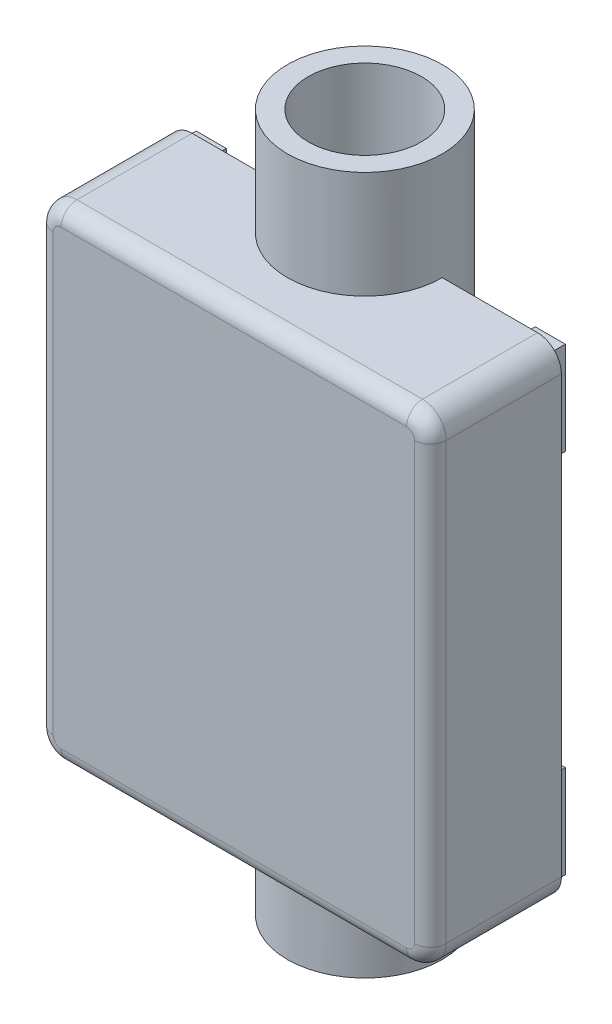
from build123d import *
from build123d.topology import SkipClean

# Parameters (mm, degrees)
BOSS_EXTRUDE1_DEPTH     = 30
BOSS_EXTRUDE2_START     = 3
BOSS_EXTRUDE2_DEPTH     = 3
SKETCH3_R               = 16.5
CUT_EXTRUDE1_DEPTH      = 134
FILLET1_R               = 4
BOSS_EXTRUDE4_DEPTH     = 10
FILLET2_R               = 4
SKETCH6_W               = 7.6
SKETCH6_H               = 23.39
SKETCH6_R               = 1.8
SKETCH6_W_2             = 4.808261044
SKETCH6_H_2             = 7.212391568
SKETCH6_H_3             = 5.330898115
SKETCH6_W_3             = 4.181096561
SKETCH6_H_4             = 6.376172255
SKETCH6_H_5             = 6.418199303
SKETCH6_H_6             = 6.534893836
BOSS_EXTRUDE5_DEPTH     = 34
FILLET5_R               = 7.5
FILLET6_R               = 7.5
FILLET7_R               = 7.5
FILLET8_R               = 7.5
SKETCH8_R               = 19.5
SKETCH8_R_2             = 14.25
BOSS_EXTRUDE6_DEPTH     = 95.74
BOSS_EXTRUDE8_START     = 40
SKETCH10_R              = 19.5
SKETCH10_R_2            = 14.25
BOSS_EXTRUDE8_DEPTH     = 40
SKETCH11_R              = 19.5
SKETCH11_R_2            = 14.25
BOSS_EXTRUDE9_DEPTH     = 40
CUT_EXTRUDE2_DEPTH      = 40
CUT_EXTRUDE2_DEPTH_BACK = 26
SKETCH12_R              = 2.5
FILLET9_R               = 4
SKETCH14_W              = 20.11766778
SKETCH14_H              = 69.863173562
SKETCH14_W_2            = 12.619264335
SKETCH14_H_2            = 61.633218561
BOSS_EXTRUDE10_DEPTH    = 14.8


with BuildPart() as part:
    # Sketch1 → Boss-Extrude1 (new body)
    with BuildSketch(Plane(origin=(0, 0, 0), x_dir=(0, 1, 0), z_dir=(0, 0, 1))):
        with BuildLine():
            Line((-54.87, 49.5), (54.87, 49.5))
            ThreePointArc((54.87, 49.5), (59.112640687, 47.742640687), (60.87, 43.5))
            Line((60.87, 43.5), (60.87, -43.5))
            ThreePointArc((60.87, -43.5), (59.112640687, -47.742640687), (54.87, -49.5))
            Line((54.87, -49.5), (-54.87, -49.5))
            ThreePointArc((-54.87, -49.5), (-59.112640687, -47.742640687), (-60.87, -43.5))
            Line((-60.87, -43.5), (-60.87, 43.5))
            ThreePointArc((-60.87, 43.5), (-59.112640687, 47.742640687), (-54.87, 49.5))
        make_face()
        with BuildLine():
            Line((-54.87, 46.5), (54.87, 46.5))
            ThreePointArc((54.87, 46.5), (56.991320344, 45.621320344), (57.87, 43.5))
            Line((57.87, 43.5), (57.87, -43.5))
            ThreePointArc((57.87, -43.5), (56.991320344, -45.621320344), (54.87, -46.5))
            Line((54.87, -46.5), (-54.87, -46.5))
            ThreePointArc((-54.87, -46.5), (-56.991320344, -45.621320344), (-57.87, -43.5))
            Line((-57.87, -43.5), (-57.87, 43.5))
            ThreePointArc((-57.87, 43.5), (-56.991320344, 45.621320344), (-54.87, 46.5))
        make_face(mode=Mode.SUBTRACT)
    extrude(amount=-BOSS_EXTRUDE1_DEPTH)

    # Sketch2 → Boss-Extrude2 (add)
    with BuildSketch(Plane.XY.offset(BOSS_EXTRUDE2_START)):
        with BuildLine():
            Line((-43.5, -60.87), (43.5, -60.87))
            ThreePointArc((43.5, -60.87), (47.742640687, -59.112640687), (49.5, -54.87))
            Line((49.5, -54.87), (49.5, 54.87))
            ThreePointArc((49.5, 54.87), (47.742640687, 59.112640687), (43.5, 60.87))
            Line((43.5, 60.87), (-43.5, 60.87))
            ThreePointArc((-43.5, 60.87), (-47.742640687, 59.112640687), (-49.5, 54.87))
            Line((-49.5, 54.87), (-49.5, -54.87))
            ThreePointArc((-49.5, -54.87), (-47.742640687, -59.112640687), (-43.5, -60.87))
        make_face()
    extrude(amount=-BOSS_EXTRUDE2_DEPTH)

    # Sketch3 → Cut-Extrude1 (cut)
    with BuildSketch(Plane(origin=(0, 60.87, 0), x_dir=(-1, 0, 0), z_dir=(0, 1, 0))):
        with Locations((0, -30)):
            Circle(SKETCH3_R)
    extrude(amount=-CUT_EXTRUDE1_DEPTH, mode=Mode.SUBTRACT)

    # Fillet1
    fillet1_edges = [part.edges().sort_by_distance(p)[0] for p in [
        (-47.742640687, -59.112640687, 3),
        (0, -60.87, 3),
        (47.742640687, -59.112640687, 3),
        (49.5, 0, 3),
        (47.742640687, 59.112640687, 3),
        (0, 60.87, 3),
        (-47.742640687, 59.112640687, 3),
        (-49.5, 0, 3),
    ]]
    fillet(fillet1_edges, radius=FILLET1_R)

    # Sketch5 → Boss-Extrude4 (add, symmetric)
    with SkipClean():  # the faces are left unmerged after this step: merging them gives an invalid solid
        with BuildSketch(Plane(origin=(0, -57.87, 0), x_dir=(-1, 0, 0), z_dir=(0, 1, 0))):
            with BuildLine():
                Line((-19.5, -30), (-16.5, -30))
                ThreePointArc((-16.5, -30), (0, -13.5), (16.5, -30))
                Line((16.5, -30), (19.5, -30))
                ThreePointArc((19.5, -30), (0, -10.5), (-19.5, -30))
            make_face()
        boss_extrude4 = extrude(amount=BOSS_EXTRUDE4_DEPTH, both=True)
    add(part.part.scale(1), mode=Mode.REPLACE)  # the faces are merged on a copy

    # Fillet2
    fillet2_edges = [part.edges().sort_by_distance(p)[0] for p in [
        (0, -57.87, -10.5),
    ]]
    fillet(fillet2_edges, radius=FILLET2_R)

    # Mirror2: Boss-Extrude4 across plane
    add(boss_extrude4.mirror(Plane.ZX))

    # Sketch6 → Boss-Extrude5 (add)
    # profile 1 of 4: a face of its own
    with BuildSketch(Plane(origin=(0, 0, 0), x_dir=(1, 0, 0), z_dir=(0, 0, -1))):
        with Locations((-42.7, 46.175)):
            Rectangle(SKETCH6_W, SKETCH6_H)
        with Locations(Location((-42.7, 46.175, 0), (0, 0, 180))):
            Circle(SKETCH6_R, mode=Mode.SUBTRACT)
        with Locations((-42.751499239, 52.734887691)):
            Rectangle(SKETCH6_W_2, SKETCH6_H_2, mode=Mode.SUBTRACT)
        with Locations((-42.751499239, 38.728214213)):
            Rectangle(SKETCH6_W_2, SKETCH6_H_3, mode=Mode.SUBTRACT)
    # profile 2 of 4: a face of its own
    with BuildSketch(Plane(origin=(0, 0, 0), x_dir=(1, 0, 0), z_dir=(0, 0, -1))):
        with Locations((42.7, 46.175)):
            Rectangle(SKETCH6_W, SKETCH6_H)
        with Locations((42.7, 46.175)):
            Circle(SKETCH6_R, mode=Mode.SUBTRACT)
        with Locations((42.647398016, 52.734887691)):
            Rectangle(SKETCH6_W_3, SKETCH6_H_2, mode=Mode.SUBTRACT)
        with Locations((42.647398016, 39.250851283)):
            Rectangle(SKETCH6_W_3, SKETCH6_H_4, mode=Mode.SUBTRACT)
    # profile 3 of 4: a face of its own
    with BuildSketch(Plane(origin=(0, 0, 0), x_dir=(1, 0, 0), z_dir=(0, 0, -1))):
        with Locations((-42.7, -46.175)):
            Rectangle(SKETCH6_W, SKETCH6_H)
        with Locations((-42.7, -46.175)):
            Circle(SKETCH6_R, mode=Mode.SUBTRACT)
        with Locations((-42.751499239, -39.688362672)):
            Rectangle(SKETCH6_W_2, SKETCH6_H_5, mode=Mode.SUBTRACT)
        with Locations((-42.751499239, -53.399970274)):
            Rectangle(SKETCH6_W_2, SKETCH6_H_6, mode=Mode.SUBTRACT)
    # profile 4 of 4: a face of its own
    with BuildSketch(Plane(origin=(0, 0, 0), x_dir=(1, 0, 0), z_dir=(0, 0, -1))):
        with Locations((42.7, -46.175)):
            Rectangle(SKETCH6_W, SKETCH6_H)
        with Locations(Location((42.7, -46.175, 0), (0, 0, 180))):
            Circle(SKETCH6_R, mode=Mode.SUBTRACT)
        with Locations((42.647398016, -39.688362672)):
            Rectangle(SKETCH6_W_3, SKETCH6_H_5, mode=Mode.SUBTRACT)
        with Locations((42.647398016, -53.399970274)):
            Rectangle(SKETCH6_W_3, SKETCH6_H_6, mode=Mode.SUBTRACT)
    extrude(amount=BOSS_EXTRUDE5_DEPTH)

    # Fillet5
    fillet5_edges = [part.edges().sort_by_distance(p)[0] for p in [
        (-46.5, 34.48, -15),
    ]]
    fillet(fillet5_edges, radius=FILLET5_R)

    # Fillet6
    fillet6_edges = [part.edges().sort_by_distance(p)[0] for p in [
        (-46.5, -34.48, -15),
    ]]
    fillet(fillet6_edges, radius=FILLET6_R)

    # Fillet7
    fillet7_edges = [part.edges().sort_by_distance(p)[0] for p in [
        (46.5, -34.48, -15),
    ]]
    fillet(fillet7_edges, radius=FILLET7_R)

    # Fillet8
    fillet8_edges = [part.edges().sort_by_distance(p)[0] for p in [
        (46.5, 34.48, -15),
    ]]
    fillet(fillet8_edges, radius=FILLET8_R)

    # Sketch8 → Boss-Extrude6 (add)
    with BuildSketch(Plane(origin=(0, -47.87, 0), x_dir=(-1, 0, 0), z_dir=(0, 1, 0))):
        with Locations((0, -30)):
            Circle(SKETCH8_R)
        with Locations(Location((0, -30, 0), (0, 0, 270))):
            Circle(SKETCH8_R_2, mode=Mode.SUBTRACT)
    extrude(amount=BOSS_EXTRUDE6_DEPTH)

    # Sketch10 → Boss-Extrude8 (add)
    with SkipClean():  # the faces are left unmerged after this step: merging them gives an invalid solid
        with BuildSketch(Plane.XZ.offset(47.87).offset(BOSS_EXTRUDE8_START)):
            with Locations((0, -30)):
                Circle(SKETCH10_R)
            with Locations(Location((0, -30, 0), (0, 0, 270))):
                Circle(SKETCH10_R_2, mode=Mode.SUBTRACT)
        extrude(amount=-BOSS_EXTRUDE8_DEPTH)
    add(part.part.scale(1), mode=Mode.REPLACE)  # the faces are merged on a copy

    # Sketch11 → Boss-Extrude9 (add)
    with BuildSketch(Plane(origin=(0, 47.87, 0), x_dir=(-1, 0, 0), z_dir=(0, 1, 0))):
        with Locations(Location((0, -30, 0), (0, 0, 90))):
            Circle(SKETCH11_R)
        with Locations(Location((0, -30, 0), (0, 0, 270))):
            Circle(SKETCH11_R_2, mode=Mode.SUBTRACT)
    extrude(amount=BOSS_EXTRUDE9_DEPTH)

    # Sketch12 → Cut-Extrude2 (cut, two sides: drawn at the far end of the back side and taken through both)
    with BuildSketch(Plane.YZ.offset(-CUT_EXTRUDE2_DEPTH_BACK)):
        with Locations(Location((0, -29.9, 0), (0, 0, 90))):
            Circle(SKETCH12_R)
        with Locations(Location((-50, -29.9, 0), (0, 0, 90))):
            Circle(SKETCH12_R)
        with Locations(Location((50, -29.9, 0), (0, 0, 90))):
            Circle(SKETCH12_R)
    extrude(amount=CUT_EXTRUDE2_DEPTH + CUT_EXTRUDE2_DEPTH_BACK, mode=Mode.SUBTRACT)

    # Fillet9
    # the kernel refuses this fillet: 4 mm, written as the material it adds along each edge
    with BuildSketch(Plane(origin=(0, 57.87, -30), x_dir=(0, 0, 1), z_dir=(1, 0, 0))) as fillet9_piece_1:
        with BuildLine():
            CenterArc((19.5 + FILLET9_R, FILLET9_R), FILLET9_R, 180, 90)
            Line((19.5, FILLET9_R), (19.5, 0))
            Line((19.5, 0), (19.5 + FILLET9_R, 0))
        make_face()
    revolve(axis=Axis((0, 57.87, -30), (0, -1, 0)), revolution_arc=90)
    with BuildSketch(Plane(origin=(0, 57.87, -30), x_dir=(1, 0, 0), z_dir=(0, 0, -1))) as fillet9_piece_2:
        with BuildLine():
            CenterArc((19.5 + FILLET9_R, FILLET9_R), FILLET9_R, 180, 90)
            Line((19.5, FILLET9_R), (19.5, 0))
            Line((19.5, 0), (19.5 + FILLET9_R, 0))
        make_face()
    revolve(axis=Axis((0, 57.87, -30), (0, -1, 0)), revolution_arc=90)

    # Sketch14 → Boss-Extrude10 (add)
    with BuildSketch(Plane(origin=(0, 0, 0), x_dir=(1, 0, 0), z_dir=(0, 0, -1))):
        with Locations((0.182887889, -1.188771278)):
            Rectangle(SKETCH14_W, SKETCH14_H)
        with Locations((0.274331833, -0.548663666)):
            Rectangle(SKETCH14_W_2, SKETCH14_H_2, mode=Mode.SUBTRACT)
    extrude(amount=BOSS_EXTRUDE10_DEPTH)


solid = part.part
